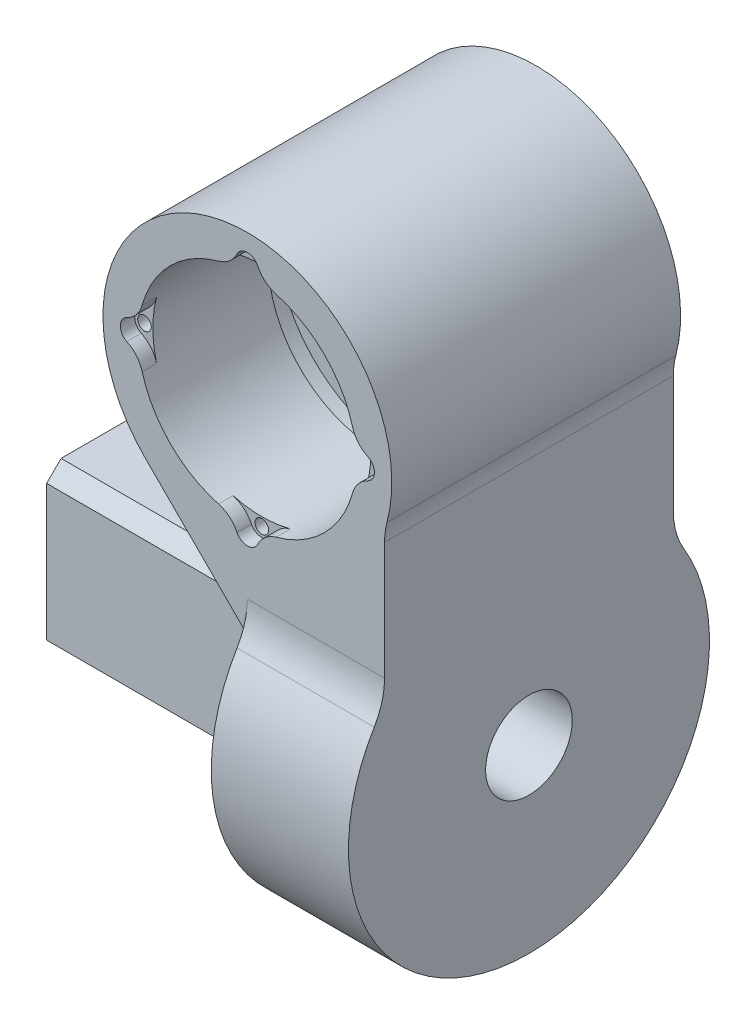
from build123d import *

# Parameters (mm, degrees)
SKETCH1_R                = 62.5
SKETCH1_R_2              = 15
BOSS_EXTRUDE1_DEPTH      = 47.5
SKETCH2_R                = 32.5
BOSS_EXTRUDE2_DEPTH      = 50
BOSS_EXTRUDE3_START      = -47.5
BOSS_EXTRUDE3_DEPTH      = 47.5
BOSS_EXTRUDE4_DEPTH      = 100
FILLET1_R                = 25
SKETCH5_W                = 57
SKETCH5_H                = 57
BOSS_EXTRUDE5_DEPTH      = 91
CHAMFER1_SIZE            = 5
SKETCH6_R                = 37.75
CUT_EXTRUDE1_DEPTH       = 100
CUT_EXTRUDE2_DEPTH       = 5
CUT_EXTRUDE2_DEPTH_BACK  = 5
SKETCH8_R                = 45
CUT_EXTRUDE3_DEPTH       = 5
CUT_EXTRUDE3_DEPTH_BACK  = 5
SKETCH9_R                = 45
CUT_EXTRUDE4_DEPTH       = 5
FILLET2_R                = 10
CIRPATTERN1_COUNT        = 4
FILLET2_OF_CIRPATTERN1_R = 10
SKETCH11_R               = 2.35
CUT_EXTRUDE5_DEPTH       = 4
SKETCH12_R               = 1.75
CUT_EXTRUDE6_DEPTH       = 4


with BuildPart() as part:
    # Sketch1 → Boss-Extrude1 (new body)
    with BuildSketch(Plane(origin=(0, 0, 0), x_dir=(0, 0, -1), z_dir=(1, 0, 0))):
        Circle(SKETCH1_R)
        Circle(SKETCH1_R_2, mode=Mode.SUBTRACT)
    extrude(amount=BOSS_EXTRUDE1_DEPTH)

    # Sketch2 → Boss-Extrude2 (add, symmetric)
    with BuildSketch(Plane.XY):
        with BuildLine():
            Line((-35.355339059, 69.644660941), (0, 34.289321881))
            Line((0, 34.289321881), (0, 55))
            ThreePointArc((0, 55), (19.134171618, 151.193976626), (-35.355339059, 69.644660941))
        make_face()
        with Locations((0, 105)):
            Circle(SKETCH2_R, mode=Mode.SUBTRACT)
    extrude(amount=BOSS_EXTRUDE2_DEPTH, both=True)

    # Sketch3 → Boss-Extrude3 (add)
    with BuildSketch(Plane(origin=(47.5, 0, 0), x_dir=(0, 0, -1), z_dir=(1, 0, 0)).offset(BOSS_EXTRUDE3_START)):
        with BuildLine():
            Line((-50, 55), (-50, 62.5))
            Line((-50, 62.5), (50, 62.5))
            Line((50, 62.5), (50, 55))
            Line((50, 55), (50, 37.5))
            ThreePointArc((50, 37.5), (40.792418173, 47.352176503), (29.685855218, 55))
            Line((29.685855218, 55), (-29.685855218, 55))
            ThreePointArc((-29.685855218, 55), (-40.792418173, 47.352176503), (-50, 37.5))
            Line((-50, 37.5), (-50, 55))
        make_face()
    extrude(amount=BOSS_EXTRUDE3_DEPTH)

    # Sketch4 → Boss-Extrude4 (add)
    with BuildSketch(Plane.XY.offset(50)):
        with BuildLine():
            Line((26.339134382, 62.5), (47.5, 62.5))
            Line((47.5, 62.5), (47.5, 89.387505004))
            ThreePointArc((47.5, 89.387505004), (39.291079432, 74.07733716), (26.339134382, 62.5))
        make_face()
    extrude(amount=-BOSS_EXTRUDE4_DEPTH)

    # Fillet1
    fillet1_edges = [part.edges().sort_by_distance(p)[0] for p in [
        (23.75, 37.5, 50),
        (23.75, 37.5, -50),
        (47.5, 89.387505004, 0),
    ]]
    fillet(fillet1_edges, radius=FILLET1_R)

    # Sketch5 → Boss-Extrude5 (add)
    with BuildSketch(Plane.ZY):
        Rectangle(SKETCH5_W, SKETCH5_H)
    extrude(amount=BOSS_EXTRUDE5_DEPTH)

    # Chamfer1
    chamfer1_edges = [part.edges().sort_by_distance(p)[0] for p in [
        (-45.5, -28.5, 28.5),
        (-45.5, 28.5, 28.5),
        (-45.5, 28.5, -28.5),
        (-45.5, -28.5, -28.5),
    ]]
    chamfer(chamfer1_edges, length=CHAMFER1_SIZE)

    # Sketch6 → Cut-Extrude1 (cut)
    with BuildSketch(Plane.XY.offset(50)):
        with Locations((0, 105)):
            Circle(SKETCH6_R)
    extrude(amount=-CUT_EXTRUDE1_DEPTH, mode=Mode.SUBTRACT)

    # Sketch8 → Cut-Extrude2 (cut, two sides: drawn at the far end of the back side and taken through both)
    with BuildSketch(Plane.XY.offset(-CUT_EXTRUDE2_DEPTH_BACK)):
        with Locations((0, 105)):
            Circle(SKETCH8_R)
    extrude(amount=CUT_EXTRUDE2_DEPTH + CUT_EXTRUDE2_DEPTH_BACK, mode=Mode.SUBTRACT)

    # Sketch9 → Cut-Extrude3 (cut, two sides: drawn at the far end of the back side and taken through both)
    with BuildSketch(Plane(origin=(0, 0, -40), x_dir=(-1, 0, 0), z_dir=(0, 0, -1)).offset(-CUT_EXTRUDE3_DEPTH_BACK)):
        with Locations(Location((0, 105, 0), (0, 0, 180))):
            Circle(SKETCH9_R)
    extrude(amount=CUT_EXTRUDE3_DEPTH + CUT_EXTRUDE3_DEPTH_BACK, mode=Mode.SUBTRACT)

    # Sketch10 → Cut-Extrude4 (cut)
    with BuildSketch(Plane.XY.offset(50)):
        with BuildLine():
            Line((-4, 142.399360944), (-4, 145))
            ThreePointArc((-4, 145), (0, 149), (4, 145))
            Line((4, 145), (4, 142.487163458))
            ThreePointArc((4, 142.487163458), (-0.003307195, 142.744592568), (-4, 142.399360944))
        make_face()
    cut_extrude4 = extrude(amount=-CUT_EXTRUDE4_DEPTH, mode=Mode.SUBTRACT)

    # Fillet2
    # the kernel refuses this fillet: 10 mm, written as the material it takes off along each edge
    with BuildSketch(Plane(origin=(-4, 142.537481269, 45), x_dir=(-0.9825908408243521, -0.18578277511139907, 0), z_dir=(0, 0, 1))) as fillet2_piece_1:
        with BuildLine():
            CenterArc((6.893121156, -9.967448048), FILLET2_R, 94.624278966, 49.061773925)
            Line((-1.164720332, -4.045354621), (-1.970504481, -3.453145278))
            ThreePointArc((-1.970504481, -3.453145278), (-1.440084404, -2.233865576), (-0.982590841, 0.185782775))
            Line((-0.982590841, 0.185782775), (0.0806213, 0.996744805))
            ThreePointArc((0.0806213, 0.996744805), (3.043454077, 0.877116383), (6.006286855, 0.996744805))
            Line((6.006286855, 0.996744805), (6.086908155, 0))
        make_face()
    extrude(amount=20.217270387, mode=Mode.SUBTRACT)
    with BuildSketch(Plane(origin=(4, 142.537481269, 45), x_dir=(0.9825908408243521, -0.18578277511139857, 0), z_dir=(0, 0, 1))) as fillet2_piece_2:
        with BuildLine():
            CenterArc((6.893121156, 9.967448048), FILLET2_R, 216.31394711, 49.061773925)
            Line((-1.164720332, 4.045354621), (-1.970504481, 3.453145278))
            ThreePointArc((-1.970504481, 3.453145278), (-1.440084404, 2.233865576), (-0.982590841, -0.185782775))
            Line((-0.982590841, -0.185782775), (0.0806213, -0.996744805))
            ThreePointArc((0.0806213, -0.996744805), (3.043454077, -0.877116383), (6.006286855, -0.996744805))
            Line((6.006286855, -0.996744805), (6.086908155, 0))
        make_face()
    extrude(amount=20.217270387, mode=Mode.SUBTRACT)

    # CirPattern1: Cut-Extrude4 ×4 about axis
    cirpattern1_axis = Axis((0, 105, 0), (0, 0, 1))
    for i in range(1, CIRPATTERN1_COUNT):
        add(cut_extrude4.rotate(cirpattern1_axis, i * 360 / CIRPATTERN1_COUNT), mode=Mode.SUBTRACT)

    # Fillet2 of CirPattern1
    # the kernel refuses this fillet: 10 mm, written as the material it takes off along each edge
    with BuildSketch(Plane(origin=(-37.537481269, 101, 45), x_dir=(0.1857827751113988, -0.9825908408243521, 0), z_dir=(0, 0, 1)), Plane(origin=(4, 67.462518731, 45), x_dir=(0.9825908408243522, 0.18578277511139812, 0), z_dir=(0, 0, 1)), Plane(origin=(37.537481269, 109, 45), x_dir=(-0.1857827751113974, 0.9825908408243524, 0), z_dir=(0, 0, 1))) as fillet2_of_cirpattern1_piece_1:
        with BuildLine():
            CenterArc((6.893121156, -9.967448048), FILLET2_OF_CIRPATTERN1_R, 94.624278966, 49.061773925)
            Line((-1.164720332, -4.045354621), (-1.970504481, -3.453145278))
            ThreePointArc((-1.970504481, -3.453145278), (-1.440084404, -2.233865576), (-0.982590841, 0.185782775))
            Line((-0.982590841, 0.185782775), (0.0806213, 0.996744805))
            ThreePointArc((0.0806213, 0.996744805), (3.043454077, 0.877116383), (6.006286855, 0.996744805))
            Line((6.006286855, 0.996744805), (6.086908155, 0))
        make_face()
    extrude(amount=20.217270387, mode=Mode.SUBTRACT)
    with BuildSketch(Plane(origin=(-37.537481269, 109, 45), x_dir=(0.18578277511140218, 0.9825908408243516, 0), z_dir=(0, 0, 1)), Plane(origin=(-4, 67.462518731, 45), x_dir=(-0.982590840824351, 0.1857827751114053, 0), z_dir=(0, 0, 1)), Plane(origin=(37.537481269, 101, 45), x_dir=(-0.18578277511140162, -0.9825908408243517, 0), z_dir=(0, 0, 1))) as fillet2_of_cirpattern1_piece_2:
        with BuildLine():
            CenterArc((6.893121156, 9.967448048), FILLET2_OF_CIRPATTERN1_R, 216.31394711, 49.061773925)
            Line((-1.164720332, 4.045354621), (-1.970504481, 3.453145278))
            ThreePointArc((-1.970504481, 3.453145278), (-1.440084404, 2.233865576), (-0.982590841, -0.185782775))
            Line((-0.982590841, -0.185782775), (0.0806213, -0.996744805))
            ThreePointArc((0.0806213, -0.996744805), (3.043454077, -0.877116383), (6.006286855, -0.996744805))
            Line((6.006286855, -0.996744805), (6.086908155, 0))
        make_face()
    extrude(amount=20.217270387, mode=Mode.SUBTRACT)

    # Sketch11 → Cut-Extrude5 (cut)
    with BuildSketch(Plane.XY.offset(45)):
        with Locations((0, 145.621023241)):
            Circle(SKETCH11_R)
        with Locations((40.621023241, 105)):
            Circle(SKETCH11_R)
        with Locations((0, 64.378976759)):
            Circle(SKETCH11_R)
        with Locations((-40.621023241, 105)):
            Circle(SKETCH11_R)
    extrude(amount=-CUT_EXTRUDE5_DEPTH, mode=Mode.SUBTRACT)

    # Sketch12 → Cut-Extrude6 (cut)
    with BuildSketch(Plane.XY.offset(41)):
        with Locations((0, 145.621023241)):
            Circle(SKETCH12_R)
        with Locations((40.621023241, 105)):
            Circle(SKETCH12_R)
        with Locations((0, 64.378976759)):
            Circle(SKETCH12_R)
        with Locations((-40.621023241, 105)):
            Circle(SKETCH12_R)
    extrude(amount=-CUT_EXTRUDE6_DEPTH, mode=Mode.SUBTRACT)


solid = part.part
